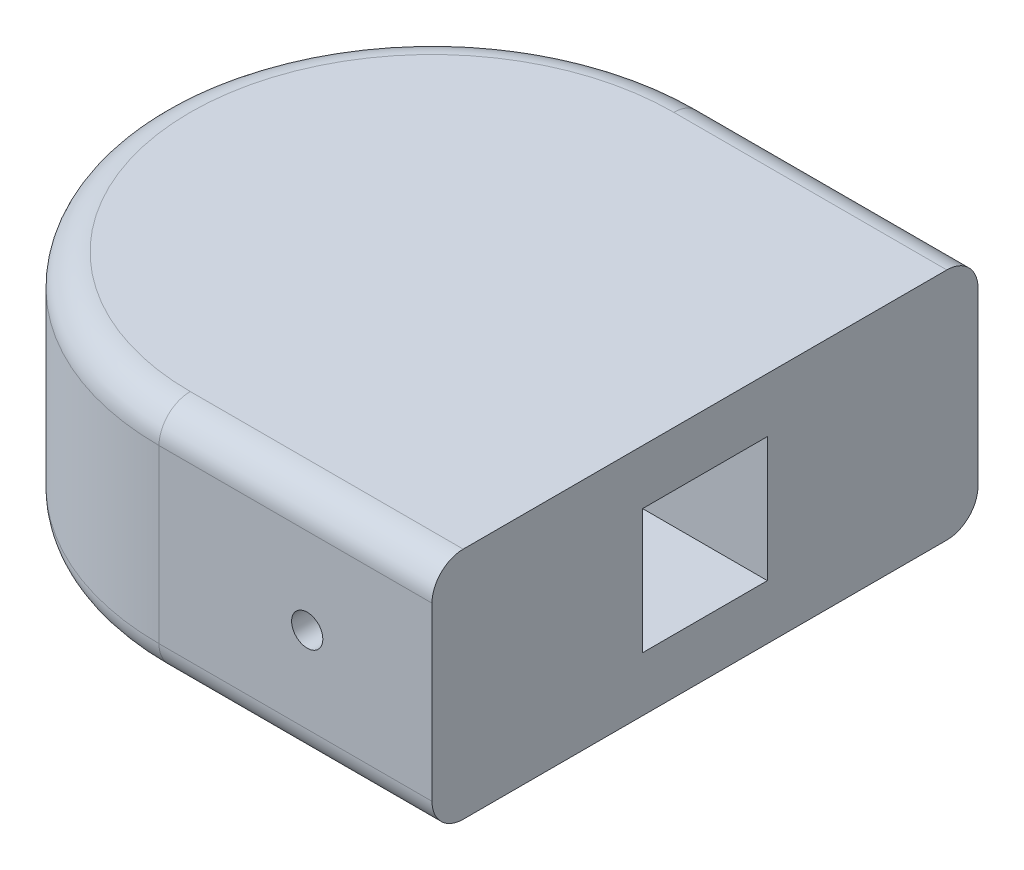
from build123d import *

# Parameters (mm, degrees)
MAIN_BODY_EXTRUDE_DEPTH         = 19.05
SKETCH2_W                       = 10.16
SKETCH2_H                       = 10.16
UPPER_FOOT_CONNECTION_CUT_DEPTH = 15.24
FILLET1_R                       = 2.54
SKETCH3_R                       = 1.27
PINHOLE_CUT_DEPTH               = 64.516


with BuildPart() as part:
    # Sketch1 → Main body extrude (new body)
    with BuildSketch(Plane(origin=(0, 0, 0), x_dir=(1, 0, 0), z_dir=(0, 1, 0))):
        with BuildLine():
            Line((44.45, 44.45), (22.225, 44.45))
            ThreePointArc((22.225, 44.45), (0, 22.225), (22.225, 0))
            Line((22.225, 0), (44.45, 0))
            Line((44.45, 0), (44.45, 44.45))
        make_face()
    extrude(amount=MAIN_BODY_EXTRUDE_DEPTH)

    # Sketch2 → Upper foot connection cut (cut)
    with BuildSketch(Plane(origin=(44.45, 0, 0), x_dir=(0, 0, -1), z_dir=(1, 0, 0))):
        with Locations((22.225, 9.525)):
            Rectangle(SKETCH2_W, SKETCH2_H)
    extrude(amount=-UPPER_FOOT_CONNECTION_CUT_DEPTH, mode=Mode.SUBTRACT)

    # Fillet1
    fillet1_edges = [part.edges().sort_by_distance(p)[0] for p in [
        (0, 0, -22.225),
        (0, 19.05, -22.225),
        (33.3375, 19.05, -44.45),
        (33.3375, 0, -44.45),
        (33.3375, 0, 0),
        (33.3375, 19.05, 0),
    ]]
    fillet(fillet1_edges, radius=FILLET1_R)

    # Sketch3 → Pinhole cut (cut)
    with BuildSketch(Plane.XY):
        with Locations((34.29, 9.525)):
            Circle(SKETCH3_R)
    extrude(amount=-PINHOLE_CUT_DEPTH, mode=Mode.SUBTRACT)


solid = part.part
